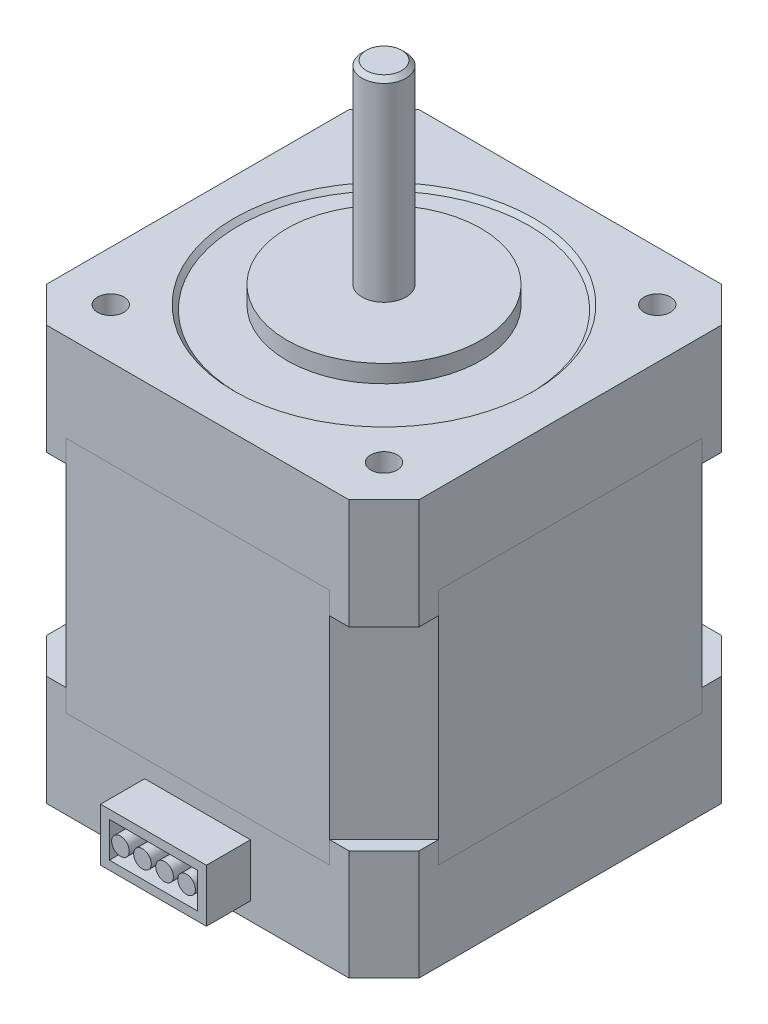
from build123d import *

# Parameters (mm, degrees)
BOSS_EXTRUDE1_DEPTH  = 10
BOSS_EXTRUDE2_DEPTH  = 2.5
BOSS_EXTRUDE6_DEPTH  = 10
BOSS_EXTRUDE7_DEPTH  = 2.5
BOSS_EXTRUDE8_REACH  = 49.578
SKETCH8_R            = 11
BOSS_EXTRUDE9_DEPTH  = 2
SKETCH9_R            = 2.5
BOSS_EXTRUDE10_DEPTH = 22
CHAMFER1_SIZE        = 0.5
SKETCH10_R           = 1.5
CUT_EXTRUDE1_DEPTH   = 5
SKETCH11_R           = 1.5
CUT_EXTRUDE2_DEPTH   = 5
SKETCH12_R           = 15
CUT_EXTRUDE3_DEPTH   = 0.5
CHAMFER2_SIZE        = 2
SKETCH13_W           = 12
SKETCH13_H           = 6
SKETCH13_W_2         = 10
SKETCH13_H_2         = 4
BOSS_EXTRUDE11_DEPTH = 5
SKETCH14_R           = 1
BOSS_EXTRUDE12_DEPTH = 5


with BuildPart() as part:
    # Sketch1 → Boss-Extrude1 (new body)
    with BuildSketch(Plane(origin=(0, 0, 0), x_dir=(1, 0, 0), z_dir=(0, 1, 0))):
        Polygon((-21.15, 17.157498476), (-17.157498476, 21.15), (17.157498476, 21.15), (21.15, 17.157498476), (21.15, -17.157498476), (17.157498476, -21.15), (-17.157498476, -21.15), (-21.15, -17.157498476), align=None)
    extrude(amount=BOSS_EXTRUDE1_DEPTH)

    # Sketch2 → Boss-Extrude2 (add)
    with BuildSketch(Plane(origin=(0, 10, 0), x_dir=(1, 0, 0), z_dir=(0, 1, 0))):
        Polygon((-17.157498476, 21.15), (-21.15, 17.157498476), (-21.15, 14.946774472), (-14.946774472, 21.15), align=None)
        Polygon((21.15, 17.157498476), (17.157498476, 21.15), (14.946774472, 21.15), (21.15, 14.946774472), align=None)
        Polygon((17.157498476, -21.15), (21.15, -17.157498476), (21.15, -14.946774472), (14.946774472, -21.15), align=None)
        Polygon((-21.15, -17.157498476), (-17.157498476, -21.15), (-14.946774472, -21.15), (-21.15, -14.946774472), align=None)
    extrude(amount=BOSS_EXTRUDE2_DEPTH)

    # Sketch11 → Cut-Extrude2 (cut)
    with BuildSketch(Plane.XZ):
        with Locations(Location((-15.5, 15.5, 0), (0, 0, 90))):
            Circle(SKETCH11_R)
        with Locations(Location((15.5, 15.5, 0), (0, 0, 90))):
            Circle(SKETCH11_R)
        with Locations(Location((15.5, -15.5, 0), (0, 0, 90))):
            Circle(SKETCH11_R)
        with Locations(Location((-15.5, -15.5, 0), (0, 0, 90))):
            Circle(SKETCH11_R)
    extrude(amount=-CUT_EXTRUDE2_DEPTH, mode=Mode.SUBTRACT)

    # Sketch13 → Boss-Extrude11 (add)
    with BuildSketch(Plane.XY.offset(21.15)):
        with Locations((0, 5)):
            Rectangle(SKETCH13_W, SKETCH13_H)
        with Locations((0, 5)):
            Rectangle(SKETCH13_W_2, SKETCH13_H_2, mode=Mode.SUBTRACT)
    extrude(amount=BOSS_EXTRUDE11_DEPTH)

    # Sketch14 → Boss-Extrude12 (add)
    with BuildSketch(Plane.XY.offset(21.15)):
        with Locations(Location((-3.75, 5, 0), (0, 0, 180))):
            Circle(SKETCH14_R)
        with Locations(Location((-1.25, 5, 0), (0, 0, 180))):
            Circle(SKETCH14_R)
        with Locations(Location((1.25, 5, 0), (0, 0, 180))):
            Circle(SKETCH14_R)
        with Locations(Location((3.75, 5, 0), (0, 0, 180))):
            Circle(SKETCH14_R)
    extrude(amount=BOSS_EXTRUDE12_DEPTH)


with BuildPart() as body_2:
    # Sketch6 → Boss-Extrude6 (new body)
    with BuildSketch(Plane(origin=(0, 47, 0), x_dir=(-1, 0, 0), z_dir=(0, -1, 0))):
        Polygon((-17.157498476, -21.15), (17.157498476, -21.15), (21.15, -17.157498476), (21.15, 17.157498476), (17.157498476, 21.15), (-17.157498476, 21.15), (-21.15, 17.157498476), (-21.15, -17.157498476), align=None)
    extrude(amount=BOSS_EXTRUDE6_DEPTH)

    # Sketch7 → Boss-Extrude7 (add)
    with BuildSketch(Plane.XZ.offset(-37)):
        Polygon((-21.15, -17.157498476), (-17.157498476, -21.15), (-14.946774472, -21.15), (-21.15, -14.946774472), align=None)
        Polygon((-17.157498476, 21.15), (-21.15, 17.157498476), (-21.15, 14.946774472), (-14.946774472, 21.15), align=None)
        Polygon((21.15, 17.157498476), (17.157498476, 21.15), (14.946774472, 21.15), (21.15, 14.946774472), align=None)
        Polygon((21.15, -14.946774472), (14.946774472, -21.15), (17.157498476, -21.15), (21.15, -17.157498476), align=None)
    extrude(amount=BOSS_EXTRUDE7_DEPTH)


with BuildPart() as body_3:

    # Sketch3 → Boss-Extrude8 (new, up to next)
    with BuildSketch(Plane(origin=(0, 10, 0), x_dir=(1, 0, 0), z_dir=(0, 1, 0)), mode=Mode.PRIVATE) as boss_extrude8_sk1:
        Polygon((-21.15, -14.946774472), (-14.946774472, -21.15), (14.946774472, -21.15), (21.15, -14.946774472), (21.15, 14.946774472), (14.946774472, 21.15), (-14.946774472, 21.15), (-21.15, 14.946774472), align=None)
    boss_extrude8_tool1 = extrude(boss_extrude8_sk1.sketch, amount=BOSS_EXTRUDE8_REACH, mode=Mode.PRIVATE) - body_2.part
    add(boss_extrude8_tool1.solids().sort_by_distance((0, 10, 0))[0])


with BuildPart() as body_4:
    # Sketch8 → Boss-Extrude9 (new body)
    with BuildSketch(Plane(origin=(0, 47, 0), x_dir=(1, 0, 0), z_dir=(0, 1, 0))):
        with Locations(Location((0, 0, 0), (0, 0, 270))):
            Circle(SKETCH8_R)
    extrude(amount=BOSS_EXTRUDE9_DEPTH)


with BuildPart() as body_5:
    # Sketch9 → Boss-Extrude10 (new body)
    with BuildSketch(Plane(origin=(0, 49, 0), x_dir=(1, 0, 0), z_dir=(0, 1, 0))):
        with Locations(Location((0, 0, 0), (0, 0, 270))):
            Circle(SKETCH9_R)
    extrude(amount=BOSS_EXTRUDE10_DEPTH)

    # Chamfer1
    chamfer1_edges = [body_5.edges().sort_by_distance(p)[0] for p in [
        (0, 71, -2.5),
    ]]
    chamfer(chamfer1_edges, length=CHAMFER1_SIZE)


with BuildPart() as body_2_1:
    add(body_2.part)

    # Sketch10 → Cut-Extrude1 (cut)
    with BuildSketch(Plane(origin=(0, 47, 0), x_dir=(1, 0, 0), z_dir=(0, 1, 0))):
        with Locations(Location((-15.5, 15.5, 0), (0, 0, 270))):
            Circle(SKETCH10_R)
        with Locations(Location((15.5, 15.5, 0), (0, 0, 270))):
            Circle(SKETCH10_R)
        with Locations(Location((15.5, -15.5, 0), (0, 0, 270))):
            Circle(SKETCH10_R)
        with Locations(Location((-15.5, -15.5, 0), (0, 0, 270))):
            Circle(SKETCH10_R)
    extrude(amount=-CUT_EXTRUDE1_DEPTH, mode=Mode.SUBTRACT)

    # Sketch12 → Cut-Extrude3 (cut)
    with BuildSketch(Plane(origin=(0, 47, 0), x_dir=(1, 0, 0), z_dir=(0, 1, 0))):
        with Locations(Location((0, 0, 0), (0, 0, 270))):
            Circle(SKETCH12_R)
    extrude(amount=-CUT_EXTRUDE3_DEPTH, mode=Mode.SUBTRACT)

    # Chamfer2
    # the kernel refuses this chamfer: 2 mm, written as the material it takes off along each edge
    with BuildSketch(Plane(origin=(0, 47, 0), x_dir=(0, 0, 1), z_dir=(-1, 0, 0))) as chamfer2_piece_1_section:
        Polygon((15 + CHAMFER2_SIZE, 0), (15, -CHAMFER2_SIZE), (15, 0), align=None)
    chamfer2_piece_1 = revolve(axis=Axis((0, 47, 0), (0, 1, 0)), mode=Mode.PRIVATE)
    chamfer2_piece_1 = split(chamfer2_piece_1, bisect_by=Plane(origin=(0, 46.5, -16.745546596), z_dir=(0, 1, 0)), keep=Keep.TOP, mode=Mode.PRIVATE)
    add(chamfer2_piece_1, mode=Mode.SUBTRACT)


solid = Compound([part.part, body_3.part, body_4.part, body_5.part, body_2_1.part])
